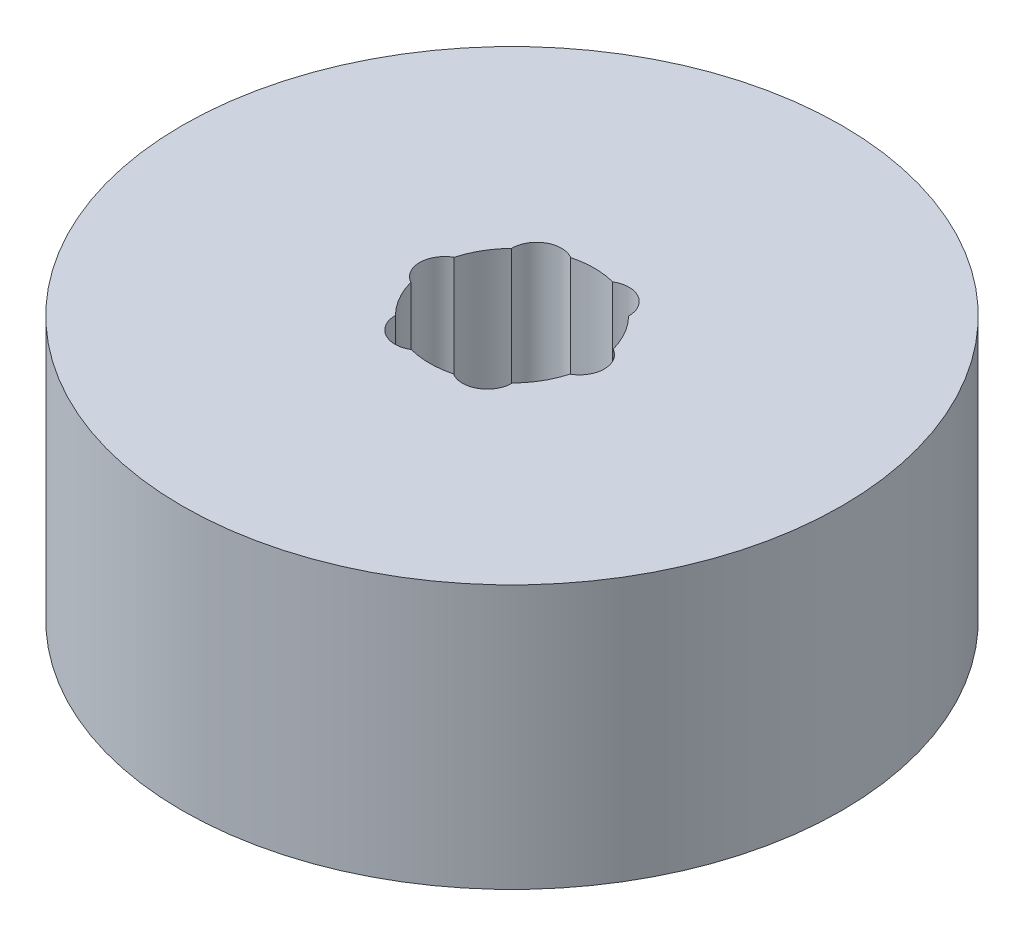
from build123d import *

# Parameters (mm, degrees)
SKETCH1_R           = 20
BOSS_EXTRUDE1_DEPTH = 16
SKETCH2_R           = 5
CUT_EXTRUDE1_DEPTH  = 33.496153619
SKETCH3_R           = 1.504714463
CUT_EXTRUDE2_DEPTH  = 12.712234161
CIRPATTERN1_COUNT   = 6


with BuildPart() as part:
    # Sketch1 → Boss-Extrude1 (new body)
    with BuildSketch(Plane(origin=(0, 0, 0), x_dir=(1, 0, 0), z_dir=(0, 1, 0))):
        Circle(SKETCH1_R)
    extrude(amount=BOSS_EXTRUDE1_DEPTH)

    # Sketch2 → Cut-Extrude1 (cut, through all)
    with BuildSketch(Plane(origin=(0, 0, 0), x_dir=(1, 0, 0), z_dir=(0, 1, 0))):
        Circle(SKETCH2_R)
    extrude(amount=CUT_EXTRUDE1_DEPTH, mode=Mode.SUBTRACT)

    # Sketch3 → Cut-Extrude2 (cut)
    with BuildSketch(Plane(origin=(0, 16, 0), x_dir=(1, 0, 0), z_dir=(0, 1, 0))):
        with Locations((-4.093144625, 0)):
            Circle(SKETCH3_R)
    cut_extrude2 = extrude(amount=-CUT_EXTRUDE2_DEPTH, mode=Mode.SUBTRACT)

    # CirPattern1: Cut-Extrude2 ×6 about axis
    cirpattern1_axis = Axis((0, 0, 0), (0, 1, 0))
    for i in range(1, CIRPATTERN1_COUNT):
        add(cut_extrude2.rotate(cirpattern1_axis, i * 360 / CIRPATTERN1_COUNT), mode=Mode.SUBTRACT)


solid = part.part
